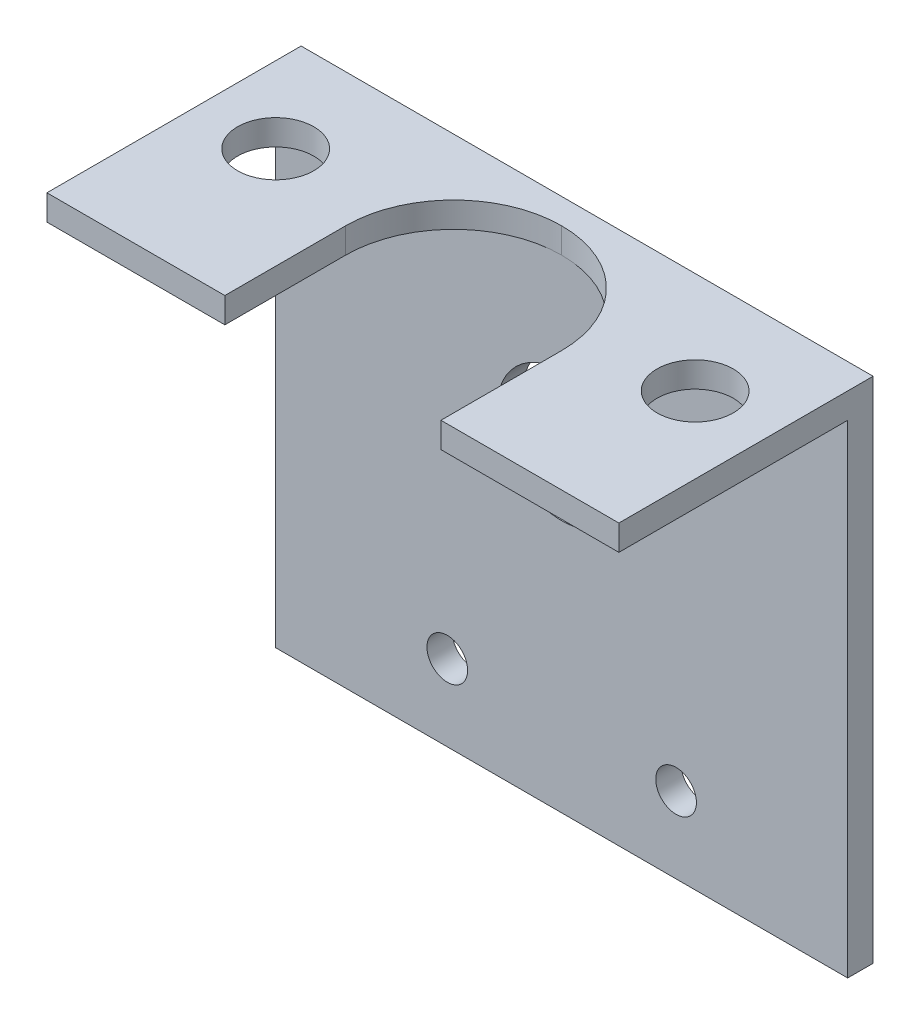
from build123d import *

# Parameters (mm, degrees)
EXTRUDE_1_DEPTH     = 45
SKETCH_2_R          = 5.1
SKETCH_2_R_2        = 1.6
CUT_EXTRUDE_1_DEPTH = 63.841069373
SKETCH_3_R          = 3
SKETCH_3_W          = 17
SKETCH_3_H          = 18
CUT_EXTRUDE_2_DEPTH = 62.587336361
FILLET_1_R          = 8.5


with BuildPart() as part:
    # ｽｹｯﾁ1 → ﾎﾞｽ - 押し出し1 (new body)
    with BuildSketch(Plane(origin=(0, 0, 0), x_dir=(0, 0, -1), z_dir=(1, 0, 0))):
        Polygon((-18, 40), (-18, 38), (0, 38), (0, 0), (2, 0), (2, 40), align=None)
    extrude(amount=EXTRUDE_1_DEPTH)

    # ｽｹｯﾁ2 → ｶｯﾄ - 押し出し1 (cut, through all)
    with BuildSketch(Plane.XY):
        with Locations((22.5, 25)):
            Circle(SKETCH_2_R)
        with Locations((13.5, 6)):
            Circle(SKETCH_2_R_2)
        with Locations((31.5, 6)):
            Circle(SKETCH_2_R_2)
    extrude(amount=-CUT_EXTRUDE_1_DEPTH, mode=Mode.SUBTRACT)

    # ｽｹｯﾁ3 → ｶｯﾄ - 押し出し2 (cut, through all)
    with BuildSketch(Plane.XZ.offset(-38)):
        with Locations(Location((6, 6, 0), (0, 0, 270))):
            Circle(SKETCH_3_R)
        with Locations(Location((39, 6, 0), (0, 0, 270))):
            Circle(SKETCH_3_R)
        with Locations((22.5, 9)):
            Rectangle(SKETCH_3_W, SKETCH_3_H)
    extrude(amount=-CUT_EXTRUDE_2_DEPTH, mode=Mode.SUBTRACT)

    # ﾌｨﾚｯﾄ1
    fillet_1_edges = [part.edges().sort_by_distance(p)[0] for p in [
        (31, 39, 0),
        (14, 39, 0),
    ]]
    fillet(fillet_1_edges, radius=FILLET_1_R - 0.0001)  # a hair under: the kernel refuses the full size


solid = part.part
